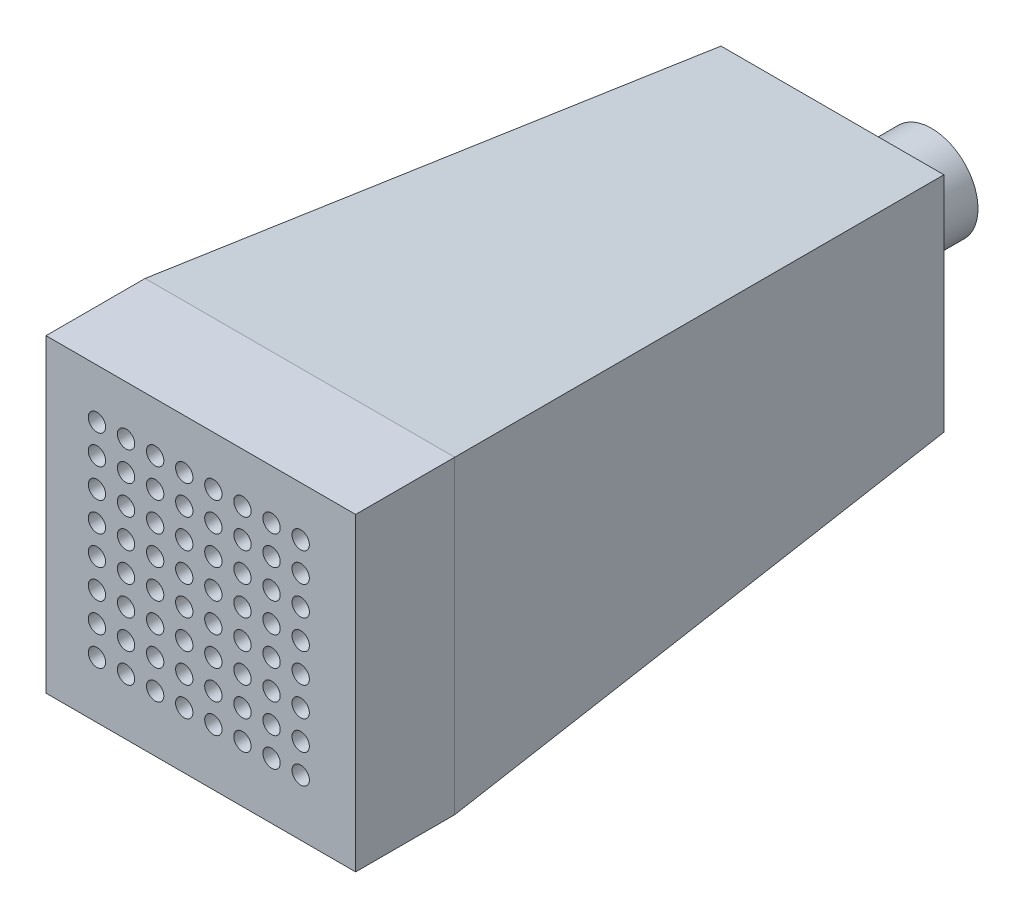
from build123d import *

# Parameters (mm, degrees)
SKETCH2_4_W         = 25
SKETCH2_4_H         = 25
BOSS_EXTRUDE2_DEPTH = 8
SKETCH5_R           = 0.7
CUT_EXTRUDE1_DEPTH  = 8
SKETCH6_R           = 3.1
SKETCH6_R_2         = 2.3
BOSS_EXTRUDE4_DEPTH = 10
CUT_EXTRUDE2_START  = -4
SKETCH6_4_R         = 2.3
CUT_EXTRUDE2_DEPTH  = 4
SKETCH1_7_R         = 3.75
SKETCH1_7_R_2       = 2.75
BOSS_EXTRUDE7_DEPTH = 8


with BuildPart() as part:
    # Sketch1 → Loft1 section 0
    with BuildSketch(Plane.XY):
        with BuildLine():
            Line((-9, 9), (9, 9))
            Line((9, 9), (9, -9))
            Line((9, -9), (-9, -9))
            Line((-9, -9), (-9, 9))
        make_face()
    # Sketch2 → Loft1 section 1
    with BuildSketch(Plane.XY.offset(43)):
        with BuildLine():
            Line((-12.5, 12.5), (12.5, 12.5))
            Line((12.5, 12.5), (12.5, -12.5))
            Line((12.5, -12.5), (-12.5, -12.5))
            Line((-12.5, -12.5), (-12.5, 12.5))
        make_face()
    loft()

    # Cut-Loft1: read off the stored shape, not the designer's step
    # Cut-Loft1: loft between two sections, ruled curve by curve
    cut_loft1_from = [
        Edge.make_bspline([(-1.944543648, -1.944543648, 0), (-1.715376982, -2.173710315, 0), (-1.426368467, -2.37918614, 0), (-0.758106945, -2.668394189, 0), (-0.379695766, -2.75, 0), (0.379695766, -2.75, 0), (0.758106945, -2.668394189, 0), (1.426368467, -2.37918614, 0), (1.715376982, -2.173710315, 0), (1.944543648, -1.944543648, 0)], [0, 0, 0, 0, 0.25, 0.25, 0.5, 0.5, 0.75, 0.75, 1, 1, 1, 1], 3),
        Edge.make_bspline([(1.944543648, -1.944543648, 0), (2.173710315, -1.715376982, 0), (2.37918614, -1.426368467, 0), (2.668394189, -0.758106945, 0), (2.75, -0.379695766, 0), (2.75, 0.379695766, 0), (2.668394189, 0.758106945, 0), (2.37918614, 1.426368467, 0), (2.173710315, 1.715376982, 0), (1.944543648, 1.944543648, 0)], [0, 0, 0, 0, 0.25, 0.25, 0.5, 0.5, 0.75, 0.75, 1, 1, 1, 1], 3),
        Edge.make_bspline([(-1.944543648, 1.944543648, 0), (-2.173710315, 1.715376982, 0), (-2.37918614, 1.426368467, 0), (-2.668394189, 0.758106945, 0), (-2.75, 0.379695766, 0), (-2.75, -0.379695766, 0), (-2.668394189, -0.758106945, 0), (-2.37918614, -1.426368467, 0), (-2.173710315, -1.715376982, 0), (-1.944543648, -1.944543648, 0)], [0, 0, 0, 0, 0.25, 0.25, 0.5, 0.5, 0.75, 0.75, 1, 1, 1, 1], 3),
        Edge.make_bspline([(1.944543648, 1.944543648, 0), (1.715376982, 2.173710315, 0), (1.426368467, 2.37918614, 0), (0.758106945, 2.668394189, 0), (0.379695766, 2.75, 0), (-0.379695766, 2.75, 0), (-0.758106945, 2.668394189, 0), (-1.426368467, 2.37918614, 0), (-1.715376982, 2.173710315, 0), (-1.944543648, 1.944543648, 0)], [0, 0, 0, 0, 0.25, 0.25, 0.5, 0.5, 0.75, 0.75, 1, 1, 1, 1], 3),
    ]
    cut_loft1_to = [
        Edge.make_bspline([(-10, -10, 43), (-8.333333333, -10, 43), (-6.666666667, -10, 43), (-3.333333333, -10, 43), (-1.666666667, -10, 43), (1.666666667, -10, 43), (3.333333333, -10, 43), (6.666666667, -10, 43), (8.333333333, -10, 43), (10, -10, 43)], [0, 0, 0, 0, 0.25, 0.25, 0.5, 0.5, 0.75, 0.75, 1, 1, 1, 1], 3),
        Edge.make_bspline([(10, -10, 43), (10, -8.333333333, 43), (10, -6.666666667, 43), (10, -3.333333333, 43), (10, -1.666666667, 43), (10, 1.666666667, 43), (10, 3.333333333, 43), (10, 6.666666667, 43), (10, 8.333333333, 43), (10, 10, 43)], [0, 0, 0, 0, 0.25, 0.25, 0.5, 0.5, 0.75, 0.75, 1, 1, 1, 1], 3),
        Edge.make_bspline([(-10, 10, 43), (-10, 8.333333333, 43), (-10, 6.666666667, 43), (-10, 3.333333333, 43), (-10, 1.666666667, 43), (-10, -1.666666667, 43), (-10, -3.333333333, 43), (-10, -6.666666667, 43), (-10, -8.333333333, 43), (-10, -10, 43)], [0, 0, 0, 0, 0.25, 0.25, 0.5, 0.5, 0.75, 0.75, 1, 1, 1, 1], 3),
        Edge.make_bspline([(10, 10, 43), (8.333333333, 10, 43), (6.666666667, 10, 43), (3.333333333, 10, 43), (1.666666667, 10, 43), (-1.666666667, 10, 43), (-3.333333333, 10, 43), (-6.666666667, 10, 43), (-8.333333333, 10, 43), (-10, 10, 43)], [0, 0, 0, 0, 0.25, 0.25, 0.5, 0.5, 0.75, 0.75, 1, 1, 1, 1], 3),
    ]
    cut_loft1 = Solid(Shell([*[Face.make_surface_from_curves(cut_loft1_from[k], cut_loft1_to[k]) for k in range(4)], Face(Wire(cut_loft1_from)), Face(Wire(cut_loft1_to))]))
    add(cut_loft1, mode=Mode.SUBTRACT)

    # Sketch2<4> → Boss-Extrude2 (add)
    with BuildSketch(Plane.XY.offset(43)):
        Rectangle(SKETCH2_4_W, SKETCH2_4_H)
    extrude(amount=BOSS_EXTRUDE2_DEPTH)

    # Sketch5 → Cut-Extrude1 (cut)
    with BuildSketch(Plane.XY.offset(43)):
        with Locations((-8.388056057, 8.509622087)):
            Circle(SKETCH5_R)
        with Locations((-6.038056057, 8.509622087)):
            Circle(SKETCH5_R)
        with Locations((-3.688056057, 8.509622087)):
            Circle(SKETCH5_R)
        with Locations((-1.338056057, 8.509622087)):
            Circle(SKETCH5_R)
        with Locations((1.011943943, 8.509622087)):
            Circle(SKETCH5_R)
        with Locations((3.361943943, 8.509622087)):
            Circle(SKETCH5_R)
        with Locations((5.711943943, 8.509622087)):
            Circle(SKETCH5_R)
        with Locations((8.061943943, 8.509622087)):
            Circle(SKETCH5_R)
        with Locations((-6.038056057, 6.159622087)):
            Circle(SKETCH5_R)
        with Locations((-3.688056057, 6.159622087)):
            Circle(SKETCH5_R)
        with Locations((-1.338056057, 6.159622087)):
            Circle(SKETCH5_R)
        with Locations((1.011943943, 6.159622087)):
            Circle(SKETCH5_R)
        with Locations((3.361943943, 6.159622087)):
            Circle(SKETCH5_R)
        with Locations((5.711943943, 6.159622087)):
            Circle(SKETCH5_R)
        with Locations((8.061943943, 6.159622087)):
            Circle(SKETCH5_R)
        with Locations((-6.038056057, 3.809622087)):
            Circle(SKETCH5_R)
        with Locations((-3.688056057, 3.809622087)):
            Circle(SKETCH5_R)
        with Locations((-1.338056057, 3.809622087)):
            Circle(SKETCH5_R)
        with Locations((1.011943943, 3.809622087)):
            Circle(SKETCH5_R)
        with Locations((3.361943943, 3.809622087)):
            Circle(SKETCH5_R)
        with Locations((5.711943943, 3.809622087)):
            Circle(SKETCH5_R)
        with Locations((8.061943943, 3.809622087)):
            Circle(SKETCH5_R)
        with Locations((-6.038056057, 1.459622087)):
            Circle(SKETCH5_R)
        with Locations((-3.688056057, 1.459622087)):
            Circle(SKETCH5_R)
        with Locations((-1.338056057, 1.459622087)):
            Circle(SKETCH5_R)
        with Locations((1.011943943, 1.459622087)):
            Circle(SKETCH5_R)
        with Locations((3.361943943, 1.459622087)):
            Circle(SKETCH5_R)
        with Locations((5.711943943, 1.459622087)):
            Circle(SKETCH5_R)
        with Locations((8.061943943, 1.459622087)):
            Circle(SKETCH5_R)
        with Locations((-6.038056057, -0.890377913)):
            Circle(SKETCH5_R)
        with Locations((-3.688056057, -0.890377913)):
            Circle(SKETCH5_R)
        with Locations((-1.338056057, -0.890377913)):
            Circle(SKETCH5_R)
        with Locations((1.011943943, -0.890377913)):
            Circle(SKETCH5_R)
        with Locations((3.361943943, -0.890377913)):
            Circle(SKETCH5_R)
        with Locations((5.711943943, -0.890377913)):
            Circle(SKETCH5_R)
        with Locations((8.061943943, -0.890377913)):
            Circle(SKETCH5_R)
        with Locations((-6.038056057, -3.240377913)):
            Circle(SKETCH5_R)
        with Locations((-3.688056057, -3.240377913)):
            Circle(SKETCH5_R)
        with Locations((-1.338056057, -3.240377913)):
            Circle(SKETCH5_R)
        with Locations((1.011943943, -3.240377913)):
            Circle(SKETCH5_R)
        with Locations((3.361943943, -3.240377913)):
            Circle(SKETCH5_R)
        with Locations((5.711943943, -3.240377913)):
            Circle(SKETCH5_R)
        with Locations((8.061943943, -3.240377913)):
            Circle(SKETCH5_R)
        with Locations((-6.038056057, -5.590377913)):
            Circle(SKETCH5_R)
        with Locations((-3.688056057, -5.590377913)):
            Circle(SKETCH5_R)
        with Locations((-1.338056057, -5.590377913)):
            Circle(SKETCH5_R)
        with Locations((1.011943943, -5.590377913)):
            Circle(SKETCH5_R)
        with Locations((3.361943943, -5.590377913)):
            Circle(SKETCH5_R)
        with Locations((5.711943943, -5.590377913)):
            Circle(SKETCH5_R)
        with Locations((8.061943943, -5.590377913)):
            Circle(SKETCH5_R)
        with Locations((-6.038056057, -7.940377913)):
            Circle(SKETCH5_R)
        with Locations((-3.688056057, -7.940377913)):
            Circle(SKETCH5_R)
        with Locations((-1.338056057, -7.940377913)):
            Circle(SKETCH5_R)
        with Locations((1.011943943, -7.940377913)):
            Circle(SKETCH5_R)
        with Locations((3.361943943, -7.940377913)):
            Circle(SKETCH5_R)
        with Locations((5.711943943, -7.940377913)):
            Circle(SKETCH5_R)
        with Locations((8.061943943, -7.940377913)):
            Circle(SKETCH5_R)
        with Locations((-8.388056057, 6.159622087)):
            Circle(SKETCH5_R)
        with Locations((-8.388056057, 3.809622087)):
            Circle(SKETCH5_R)
        with Locations((-8.388056057, 1.459622087)):
            Circle(SKETCH5_R)
        with Locations((-8.388056057, -0.890377913)):
            Circle(SKETCH5_R)
        with Locations((-8.388056057, -3.240377913)):
            Circle(SKETCH5_R)
        with Locations((-8.388056057, -5.590377913)):
            Circle(SKETCH5_R)
        with Locations((-8.388056057, -7.940377913)):
            Circle(SKETCH5_R)
    extrude(amount=CUT_EXTRUDE1_DEPTH, mode=Mode.SUBTRACT)

    # Sketch6 → Boss-Extrude4 (add)
    with BuildSketch(Plane(origin=(-8.940765615, 0, -0.727736736), x_dir=(-0.08112705090276601, 0, 0.9967037682339824), z_dir=(-0.9967037682339824, 0, -0.08112705090276602))):
        with Locations(Location((34.477535136, -1.520969622, 0), (0, 0, 180))):
            Circle(SKETCH6_R)
        with Locations((34.477535136, -1.520969622)):
            Circle(SKETCH6_R_2, mode=Mode.SUBTRACT)
    extrude(amount=BOSS_EXTRUDE4_DEPTH)

    # Sketch6<4> → Cut-Extrude2 (cut)
    with BuildSketch(Plane(origin=(-8.940765615, 0, -0.727736736), x_dir=(-0.08112705090276601, 0, 0.9967037682339824), z_dir=(-0.9967037682339824, 0, -0.08112705090276602)).offset(CUT_EXTRUDE2_START)):
        with Locations((34.477535136, -1.520969622)):
            Circle(SKETCH6_4_R)
    extrude(amount=CUT_EXTRUDE2_DEPTH, mode=Mode.SUBTRACT)

    # Sketch1<7> → Boss-Extrude7 (add)
    with BuildSketch(Plane.XY):
        Circle(SKETCH1_7_R)
        Circle(SKETCH1_7_R_2, mode=Mode.SUBTRACT)
    extrude(amount=-BOSS_EXTRUDE7_DEPTH)


solid = part.part
